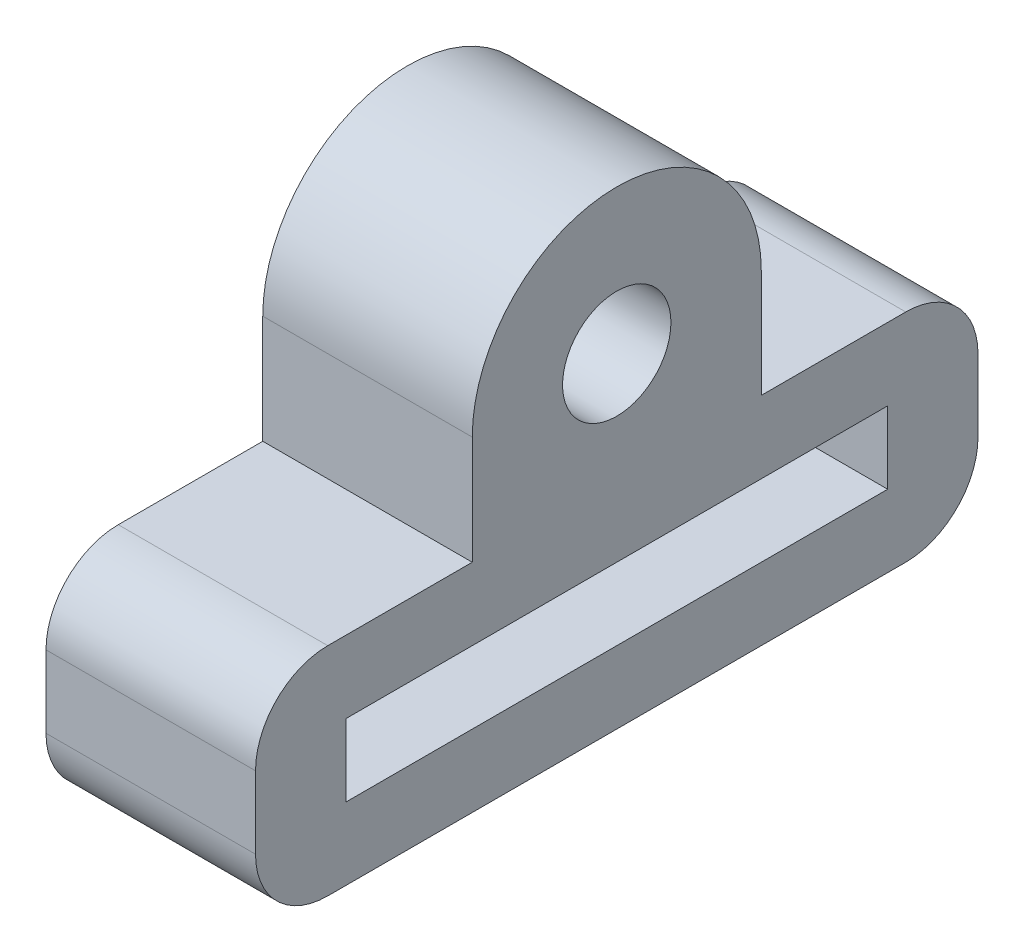
from build123d import *

# Parameters (mm, degrees)
CROQUIS1_R              = 1.5
CROQUIS1_W              = 15
CROQUIS1_H              = 2
SALIENTE_EXTRUIR1_DEPTH = 2.9


with BuildPart() as part:
    # Croquis1 → Saliente-Extruir1 (new, symmetric)
    with BuildSketch(Plane(origin=(0, 0, 0), x_dir=(0, 0, -1), z_dir=(1, 0, 0))):
        with BuildLine():
            Line((-10, 1), (-10, -1))
            ThreePointArc((-10, -1), (-9.414213562, -2.414213562), (-8, -3))
            Line((-8, -3), (8, -3))
            ThreePointArc((8, -3), (9.414213562, -2.414213562), (10, -1))
            Line((10, -1), (10, 1))
            ThreePointArc((10, 1), (9.414213562, 2.414213562), (8, 3))
            Line((8, 3), (4, 3))
            Line((4, 3), (4, 6))
            ThreePointArc((4, 6), (0, 10), (-4, 6))
            Line((-4, 6), (-4, 3))
            Line((-4, 3), (-8, 3))
            ThreePointArc((-8, 3), (-9.414213562, 2.414213562), (-10, 1))
        make_face()
        with Locations((0, 6)):
            Circle(CROQUIS1_R, mode=Mode.SUBTRACT)
        Rectangle(CROQUIS1_W, CROQUIS1_H, mode=Mode.SUBTRACT)
    extrude(amount=SALIENTE_EXTRUIR1_DEPTH, both=True)


solid = part.part
